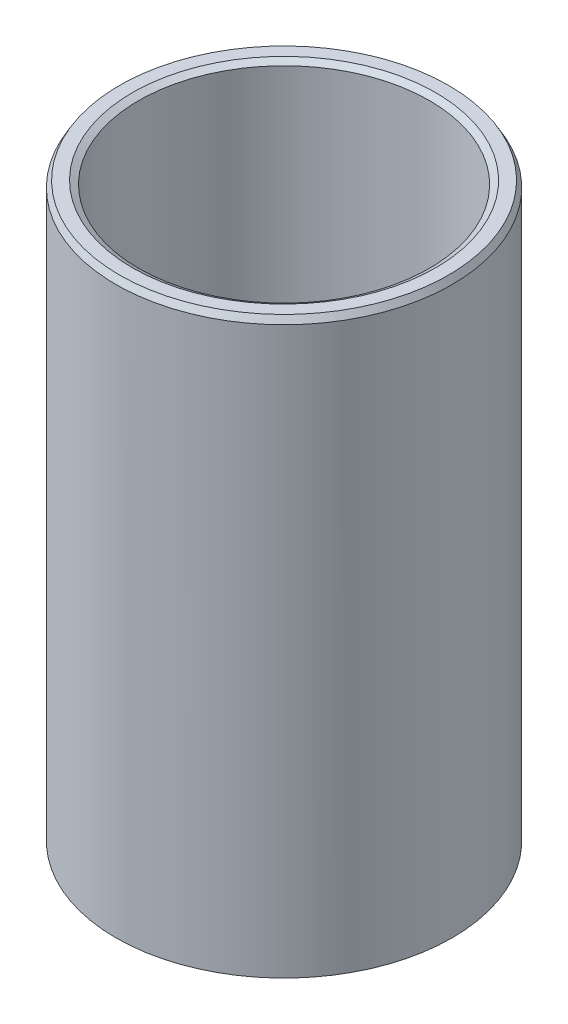
from build123d import *
from OCP.BRepFilletAPI import BRepFilletAPI_MakeChamfer

# Parameters (mm, degrees)
SKETCH1_R           = 45
BOSS_EXTRUDE1_DEPTH = 154.16567837
SKETCH2_R           = 38.923058159
CUT_EXTRUDE1_DEPTH  = 167.784460869
CHAMFER1_SIZE       = 1.694860442
CHAMFER1_SIZE2      = 0.978528133


with BuildPart() as part:
    # Sketch1 → Boss-Extrude1 (new body)
    with BuildSketch(Plane(origin=(0, 0, 0), x_dir=(1, 0, 0), z_dir=(0, 1, 0))):
        Circle(SKETCH1_R)
    extrude(amount=BOSS_EXTRUDE1_DEPTH)

    # Sketch2 → Cut-Extrude1 (cut, through all)
    with BuildSketch(Plane(origin=(0, 0, 0), x_dir=(1, 0, 0), z_dir=(0, 1, 0))):
        Circle(SKETCH2_R)
    extrude(amount=CUT_EXTRUDE1_DEPTH, mode=Mode.SUBTRACT)

    # Chamfer1: one chamfer whose edges measure the first distance from different faces: ONE call of the kernel's chamfer builder (chamfer() names one face for all edges)
    chamfer1_edges_1 = [part.edges().sort_by_distance(p)[0] for p in [
        (-38.923058159, 154.16567837, 0),
    ]]
    chamfer1_side_1 = [part.faces().sort_by_distance(p)[0] for p in [
        (-43.727207794, 154.16567837, 0),
    ]]
    chamfer1_edges_2 = [part.edges().sort_by_distance(p)[0] for p in [
        (-38.923058159, 0, 0),
    ]]
    chamfer1_side_2 = [part.faces().sort_by_distance(p)[0] for p in [
        (-38.923058159, 77.082839185, 0),
    ]]
    chamfer1_edges_3 = [part.edges().sort_by_distance(p)[0] for p in [
        (-45, 0, 0),
    ]]
    chamfer1_side_3 = [part.faces().sort_by_distance(p)[0] for p in [
        (-43.727207794, 0, 0),
    ]]
    chamfer1_edges_4 = [part.edges().sort_by_distance(p)[0] for p in [
        (-45, 154.16567837, 0),
    ]]
    chamfer1_side_4 = [part.faces().sort_by_distance(p)[0] for p in [
        (-45, 77.082839185, 0),
    ]]
    chamfer1 = BRepFilletAPI_MakeChamfer(part.part.solid().wrapped)
    for e in chamfer1_edges_1:
        chamfer1.Add(CHAMFER1_SIZE, CHAMFER1_SIZE2, e.wrapped, chamfer1_side_1[0].wrapped)  # the first distance lies on this face
    for e in chamfer1_edges_2:
        chamfer1.Add(CHAMFER1_SIZE, CHAMFER1_SIZE2, e.wrapped, chamfer1_side_2[0].wrapped)  # the first distance lies on this face
    for e in chamfer1_edges_3:
        chamfer1.Add(CHAMFER1_SIZE, CHAMFER1_SIZE2, e.wrapped, chamfer1_side_3[0].wrapped)  # the first distance lies on this face
    for e in chamfer1_edges_4:
        chamfer1.Add(CHAMFER1_SIZE, CHAMFER1_SIZE2, e.wrapped, chamfer1_side_4[0].wrapped)  # the first distance lies on this face
    add(Compound.cast(chamfer1.Shape()), mode=Mode.REPLACE)


solid = part.part
